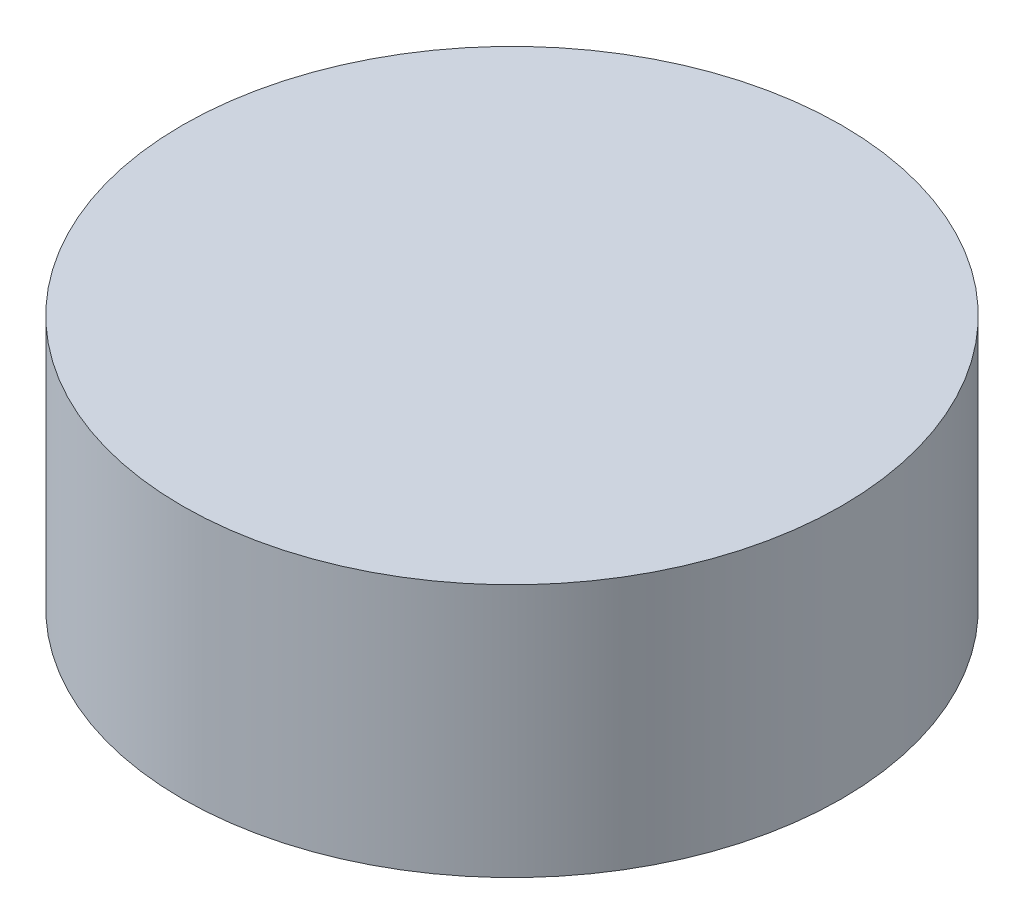
from build123d import *

# Parameters (mm, degrees)
SKETCH_1_R            = 32.5
ABOT_LEFT_WHEEL_DEPTH = 25


with BuildPart() as part:
    # Эскиз1 → abot_left_wheel (new body)
    with BuildSketch(Plane(origin=(0, 0, 0), x_dir=(1, 0, 0), z_dir=(0, 1, 0))):
        Circle(SKETCH_1_R)
    extrude(amount=ABOT_LEFT_WHEEL_DEPTH)


solid = part.part
